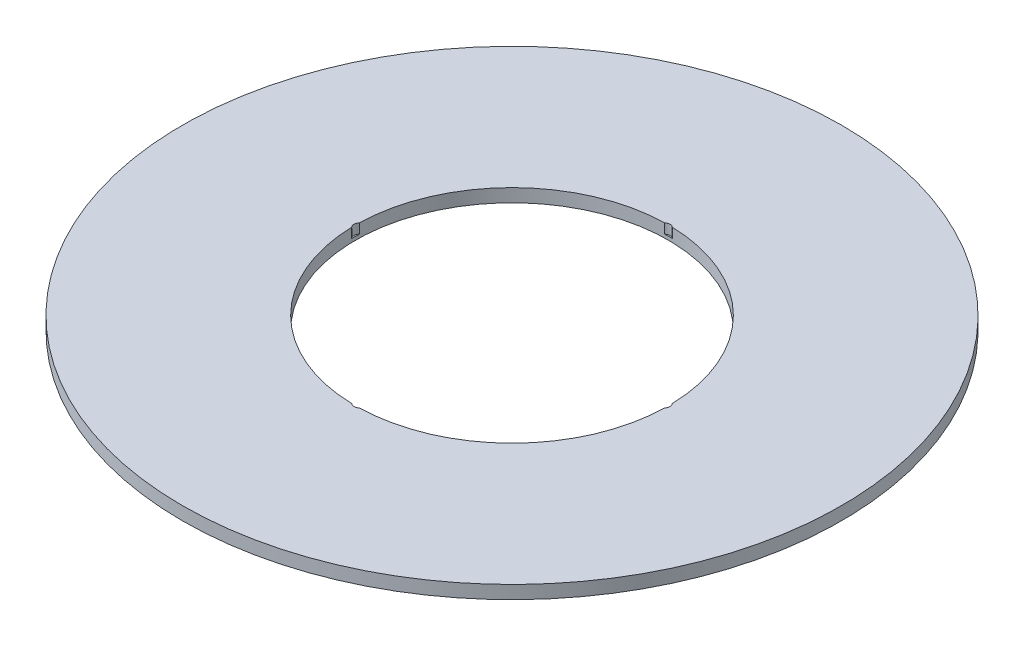
from build123d import *

# Parameters (mm, degrees)
SKETCH1_R           = 100
BOSS_EXTRUDE1_DEPTH = 4
SKETCH2_R           = 47.5
CUT_EXTRUDE1_DEPTH  = 142.477913471
SKETCH3_R           = 1.657982789
CUT_EXTRUDE2_DEPTH  = 2.973991022
CIRPATTERN1_COUNT   = 4


with BuildPart() as part:
    # Sketch1 → Boss-Extrude1 (new body)
    with BuildSketch(Plane(origin=(0, 0, 0), x_dir=(1, 0, 0), z_dir=(0, 1, 0))):
        Circle(SKETCH1_R)
    extrude(amount=BOSS_EXTRUDE1_DEPTH)

    # Sketch2 → Cut-Extrude1 (cut, through all)
    with BuildSketch(Plane(origin=(0, 0, 0), x_dir=(1, 0, 0), z_dir=(0, 1, 0))):
        Circle(SKETCH2_R)
    extrude(amount=CUT_EXTRUDE1_DEPTH, mode=Mode.SUBTRACT)

    # Sketch3 → Cut-Extrude2 (cut)
    with BuildSketch(Plane(origin=(0, 4, 0), x_dir=(1, 0, 0), z_dir=(0, 1, 0))):
        with Locations((-46.284652657, 0)):
            Circle(SKETCH3_R)
    cut_extrude2 = extrude(amount=-CUT_EXTRUDE2_DEPTH, mode=Mode.SUBTRACT)

    # CirPattern1: Cut-Extrude2 ×4 about axis
    cirpattern1_axis = Axis((0, 0, 0), (0, 1, 0))
    for i in range(1, CIRPATTERN1_COUNT):
        add(cut_extrude2.rotate(cirpattern1_axis, i * 360 / CIRPATTERN1_COUNT), mode=Mode.SUBTRACT)


solid = part.part
